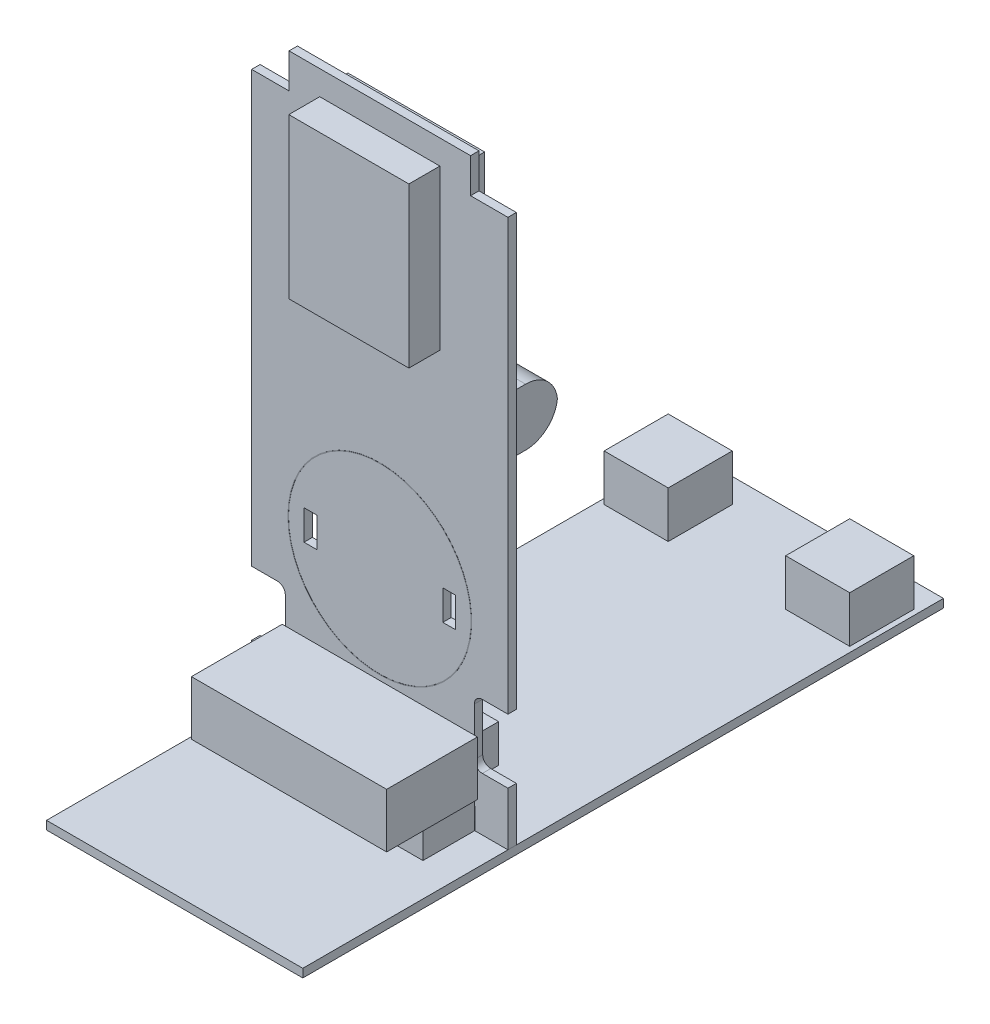
from build123d import *

# Parameters (mm, degrees)
SKETCH1_R                         = 2.55
SKETCH1_R_2                       = 0.75
SKETCH1_W                         = 1.2
SKETCH1_H                         = 2.8
SKETCH1_W_2                       = 16.25
SKETCH1_H_2                       = 3.55
BOSS_EXTRUDE3_DEPTH               = 0.7874
SKETCH6_R                         = 8.6
SKETCH6_R_2                       = 8.55
EXTRUDE_THIN1_DEPTH               = 0.01
SKETCH2_W                         = 24
SKETCH2_H                         = 60
SKETCH2_W_2                       = 17.8
SKETCH2_H_2                       = 0.7874
BOSS_EXTRUDE6_DEPTH               = 0.7874
SKETCH3_R                         = 5
BOSS_EXTRUDE7_DEPTH               = 5
SKETCH4_W                         = 6
SKETCH4_H                         = 6
BOSS_EXTRUDE8_DEPTH               = 4.35
BOSS_EXTRUDE8_2_DEPTH             = 4.35
SKETCH5_W                         = 17.468941522
SKETCH5_H                         = 5.356170352
BOSS_EXTRUDE9_DEPTH               = 7.13
FILLET1_R                         = 3
FEMALE_START                      = -8.125
FEMALE_CONNECTOR_DEPTH            = 16.25
FEMALE_START_2                    = -9.14
FEMALE_CONNECTOR_2_OUTLINE_W      = 5.08
FEMALE_CONNECTOR_2_OUTLINE_H      = 8.5
FEMALE_CONNECTOR_2_DEPTH          = 18.28
SKETCH10_W                        = 12.803875086
SKETCH10_H                        = 14.58902636
BOSS_EXTRUDE11_DEPTH              = 2.63
PCB_START                         = -41.141819053
PCB_CONNECTOR_QUARK_OUTLINE_W     = 15.24
PCB_CONNECTOR_QUARK_OUTLINE_H     = 3.22
PCB_CONNECTOR_QUARK_DEPTH         = 12.44
PCB_START_2                       = -31.921819053
PCB_CONNECTOR_QUARK_2_OUTLINE_W   = 15.24
PCB_CONNECTOR_QUARK_2_OUTLINE_H   = 3.865
PCB_CONNECTOR_QUARK_2_DEPTH       = 3.22
PCB_START_3                       = -35.301819053
PCB_CONNECTOR_QUARK_3_OUTLINE_W   = 17.78
PCB_CONNECTOR_QUARK_3_OUTLINE_H   = 4.85
PCB_CONNECTOR_QUARK_3_OUTLINE_W_2 = 15.24
PCB_CONNECTOR_QUARK_3_OUTLINE_H_2 = 3.22
PCB_CONNECTOR_QUARK_3_DEPTH       = 2.54
FILLET2_R                         = 0.75
SKETCH16_W                        = 11.24724057
SKETCH16_H                        = 14.93660129
BOSS_EXTRUDE12_DEPTH              = 2.9
SKETCH17_W                        = 3.22
SKETCH17_H                        = 4.619876858
CUT_EXTRUDE1_DEPTH                = 23


with BuildPart() as part:
    # Sketch1 → Boss-Extrude3 (new body)
    with BuildSketch(Plane.XY):
        Polygon((8.5, 9.75), (-8.5, 9.75), (-8.5, 6.5), (-12, 6.5), (-12, -33.8), (-8.85, -33.8), (-8.85, -39.8), (-12, -39.8), (-12, -44.8), (-8.9, -44.8), (-8.9, -42.8), (8.9, -42.8), (8.9, -44.8), (12, -44.8), (12, -39.8), (8.85, -39.8), (8.85, -33.8), (12, -33.8), (12, 6.5), (8.5, 6.5), align=None)
        Circle(SKETCH1_R, mode=Mode.SUBTRACT)
        with Locations((-4.2, -5.6)):
            Circle(SKETCH1_R_2, mode=Mode.SUBTRACT)
        with Locations((4.2, -5.6)):
            Circle(SKETCH1_R_2, mode=Mode.SUBTRACT)
        with Locations((6.5, -28)):
            Rectangle(SKETCH1_W, SKETCH1_H, mode=Mode.SUBTRACT)
        with Locations((-6.5, -28)):
            Rectangle(SKETCH1_W, SKETCH1_H, mode=Mode.SUBTRACT)
        with Locations((0, -39.6122)):
            Rectangle(SKETCH1_W_2, SKETCH1_H_2, mode=Mode.SUBTRACT)
    extrude(amount=BOSS_EXTRUDE3_DEPTH)

    # Sketch6 → Extrude-Thin1 (add)
    with BuildSketch(Plane.XY.offset(0.7874)):
        with Locations((0, -28)):
            Circle(SKETCH6_R)
        with Locations((0, -28)):
            Circle(SKETCH6_R_2, mode=Mode.SUBTRACT)
    extrude(amount=EXTRUDE_THIN1_DEPTH)

    # Sketch5 → Boss-Extrude9 (add)
    with BuildSketch(Plane(origin=(0, 0, 0), x_dir=(-1, 0, 0), z_dir=(0, 0, -1))):
        with Locations((0, -13.8)):
            Rectangle(SKETCH5_W, SKETCH5_H)
    extrude(amount=BOSS_EXTRUDE9_DEPTH)

    # Fillet1
    # the kernel refuses this fillet: 3 mm, written as the material it takes off along each edge
    with BuildSketch(Plane(origin=(16.234470761, -16.478085176, -7.13), x_dir=(0, 0, 1), z_dir=(-1, 0, 0)), Plane(origin=(-16.234470761, -11.121914824, -7.13), x_dir=(0, 0, 1), z_dir=(1, 0, 0))) as fillet1_piece_1:
        with BuildLine():
            CenterArc((FILLET1_R, FILLET1_R), FILLET1_R, 180, 90)
            Line((0, FILLET1_R), (0, 0))
            Line((0, 0), (FILLET1_R, 0))
        make_face()
    extrude(amount=32.468941522, mode=Mode.SUBTRACT)

    # Sketch10 → Boss-Extrude11 (add)
    with BuildSketch(Plane(origin=(0, 0, 0), x_dir=(-1, 0, 0), z_dir=(0, 0, -1))):
        Rectangle(SKETCH10_W, SKETCH10_H)
    extrude(amount=BOSS_EXTRUDE11_DEPTH)

    # Fillet2
    fillet2_edges = [part.edges().sort_by_distance(p)[0] for p in [
        (-8.85, -39.8, 0.3937),
        (-8.85, -33.8, 0.3937),
        (8.85, -33.8, 0.3937),
        (8.85, -39.8, 0.3937),
    ]]
    fillet(fillet2_edges, radius=FILLET2_R)

    # Sketch16 → Boss-Extrude12 (add)
    with BuildSketch(Plane.XY.offset(0.7874)):
        Rectangle(SKETCH16_W, SKETCH16_H)
    extrude(amount=BOSS_EXTRUDE12_DEPTH)


with BuildPart() as body_2:
    # Sketch2 → Boss-Extrude6 (new body)
    with BuildSketch(Plane.XZ.offset(44.8)):
        with Locations((0, -10)):
            Rectangle(SKETCH2_W, SKETCH2_H)
        with Locations((0, 0.3937)):
            Rectangle(SKETCH2_W_2, SKETCH2_H_2, mode=Mode.SUBTRACT)
    extrude(amount=BOSS_EXTRUDE6_DEPTH)


with BuildPart() as body_3:
    # Sketch3 → Boss-Extrude7 (new body)
    with BuildSketch(Plane.XZ.offset(45.5874)):
        with Locations(Location((0, -10, 0), (0, 0, 270))):
            Circle(SKETCH3_R)
    extrude(amount=BOSS_EXTRUDE7_DEPTH)


with BuildPart() as body_4:
    # Sketch4 → Boss-Extrude8 (new body)
    with BuildSketch(Plane(origin=(0, -44.8, 0), x_dir=(1, 0, 0), z_dir=(0, 1, 0))):
        with Locations((-8.5, 34.72)):
            Rectangle(SKETCH4_W, SKETCH4_H)
    extrude(amount=BOSS_EXTRUDE8_DEPTH)


with BuildPart() as body_5:
    # Sketch4 → Boss-Extrude8 2 (new body)
    with BuildSketch(Plane(origin=(0, -44.8, 0), x_dir=(1, 0, 0), z_dir=(0, 1, 0))):
        with Locations((8.5, 34.72)):
            Rectangle(SKETCH4_W, SKETCH4_H)
    extrude(amount=BOSS_EXTRUDE8_2_DEPTH)


with BuildPart() as body_6:
    # Female Connector: read off the stored shape, not the designer's step
    # Female Connector outline → Female Connector (new body)
    with BuildSketch(Plane.YZ.offset(FEMALE_START)):
        Polygon((-37.8372, -2.2126), (-37.8372, 0.7874), (-37.0722, 0.7874), (-37.0722, 9.2874), (-42.1522, 9.2874), (-42.1522, 0.7874), (-41.3872, 0.7874), (-41.3872, -2.2126), align=None)
    extrude(amount=FEMALE_CONNECTOR_DEPTH)

    # Female Connector 2 outline → Female Connector 2 (add)
    with BuildSketch(Plane.YZ.offset(FEMALE_START_2)):
        with Locations((-39.6122, 5.0374)):
            Rectangle(FEMALE_CONNECTOR_2_OUTLINE_W, FEMALE_CONNECTOR_2_OUTLINE_H)
    extrude(amount=FEMALE_CONNECTOR_2_DEPTH)


with BuildPart() as body_7:
    # PCB CONNECTOR_Quark: read off the stored shape, not the designer's step
    # PCB CONNECTOR_Quark outline → PCB CONNECTOR_Quark (new body)
    with BuildSketch(Plane(origin=(0, 0, 0), x_dir=(1, 0, 0), z_dir=(0, 1, 0)).offset(PCB_START)):
        with Locations((12.610768587, -17.421401355)):
            Rectangle(PCB_CONNECTOR_QUARK_OUTLINE_W, PCB_CONNECTOR_QUARK_OUTLINE_H)
    extrude(amount=PCB_CONNECTOR_QUARK_DEPTH)

    # PCB CONNECTOR_Quark 2 outline → PCB CONNECTOR_Quark 2 (add)
    with BuildSketch(Plane(origin=(0, 0, 0), x_dir=(1, 0, 0), z_dir=(0, 1, 0)).offset(PCB_START_2)):
        with Locations((12.610768587, -13.878901355)):
            Rectangle(PCB_CONNECTOR_QUARK_2_OUTLINE_W, PCB_CONNECTOR_QUARK_2_OUTLINE_H)
    extrude(amount=PCB_CONNECTOR_QUARK_2_DEPTH)

    # PCB CONNECTOR_Quark 3 outline → PCB CONNECTOR_Quark 3 (add)
    with BuildSketch(Plane(origin=(0, 0, 0), x_dir=(1, 0, 0), z_dir=(0, 1, 0)).offset(PCB_START_3)):
        with Locations((12.610768587, -17.421401355)):
            Rectangle(PCB_CONNECTOR_QUARK_3_OUTLINE_W, PCB_CONNECTOR_QUARK_3_OUTLINE_H)
        with Locations((12.610768587, -17.421401355)):
            Rectangle(PCB_CONNECTOR_QUARK_3_OUTLINE_W_2, PCB_CONNECTOR_QUARK_3_OUTLINE_H_2, mode=Mode.SUBTRACT)
    extrude(amount=PCB_CONNECTOR_QUARK_3_DEPTH)


with BuildPart() as body_7_1:
    # Body-Move/Copy6: read off the stored shape, not the designer's step
    # Body-Move/Copy6: moved
    add(body_7.part.moved(Location((-12.6107686, -9.4981809, -14.2090014))))

    # Sketch17 → Cut-Extrude1 (cut)
    with BuildSketch(Plane.ZY.offset(7.62)):
        with Locations((3.2124, -48.330061571)):
            Rectangle(SKETCH17_W, SKETCH17_H)
    extrude(amount=-CUT_EXTRUDE1_DEPTH, mode=Mode.SUBTRACT)


solid = Compound([part.part, body_2.part, body_3.part, body_4.part, body_5.part, body_6.part, body_7_1.part])
